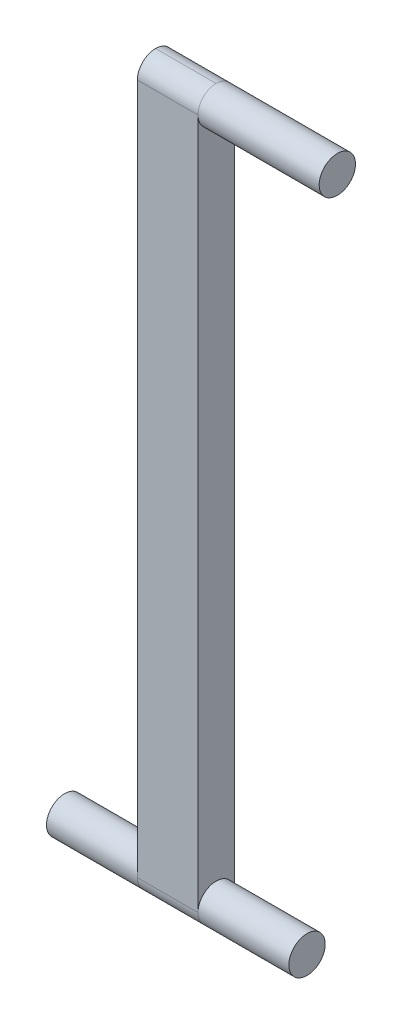
from build123d import *

# Parameters (mm, degrees)
SKETCH1_W                = 5
SKETCH1_H                = 60
BOSS_EXTRUDE1_DEPTH      = 3
SKETCH2_R                = 1.5
BOSS_EXTRUDE2_DEPTH      = 10
FILLET1_R                = 1.5
BOSS_EXTRUDE3_DEPTH      = 10
BOSS_EXTRUDE3_DEPTH_BACK = 10
SKETCH3_R                = 1.5
FILLET2_R                = 1.5


with BuildPart() as part:
    # Sketch1 → Boss-Extrude1 (new body)
    with BuildSketch(Plane.XY):
        Rectangle(SKETCH1_W, SKETCH1_H)
    extrude(amount=BOSS_EXTRUDE1_DEPTH)

    # Sketch2 → Boss-Extrude2 (add)
    with BuildSketch(Plane(origin=(2.5, 0, 0), x_dir=(0, 0, -1), z_dir=(1, 0, 0))):
        with Locations(Location((-1.5, 28.5, 0), (0, 0, 90))):
            Circle(SKETCH2_R)
    extrude(amount=BOSS_EXTRUDE2_DEPTH)

    # Fillet1
    fillet1_edges = [part.edges().sort_by_distance(p)[0] for p in [
        (0, 30, 3),
        (0, 30, 0),
    ]]
    fillet(fillet1_edges, radius=FILLET1_R - 0.0001)  # a hair under: the kernel refuses the full size

    # Sketch3 → Boss-Extrude3 (add, two sides: drawn at the far end of the back side and taken through both)
    with BuildSketch(Plane.ZY.offset(-BOSS_EXTRUDE3_DEPTH_BACK)):
        with Locations(Location((1.5, -28.5, 0), (0, 0, 270))):
            Circle(SKETCH3_R)
    extrude(amount=BOSS_EXTRUDE3_DEPTH + BOSS_EXTRUDE3_DEPTH_BACK)

    # Fillet2
    fillet2_edges = [part.edges().sort_by_distance(p)[0] for p in [
        (0, -30, 3),
        (0, -30, 0),
    ]]
    fillet(fillet2_edges, radius=FILLET2_R - 0.0001)  # a hair under: the kernel refuses the full size


solid = part.part
